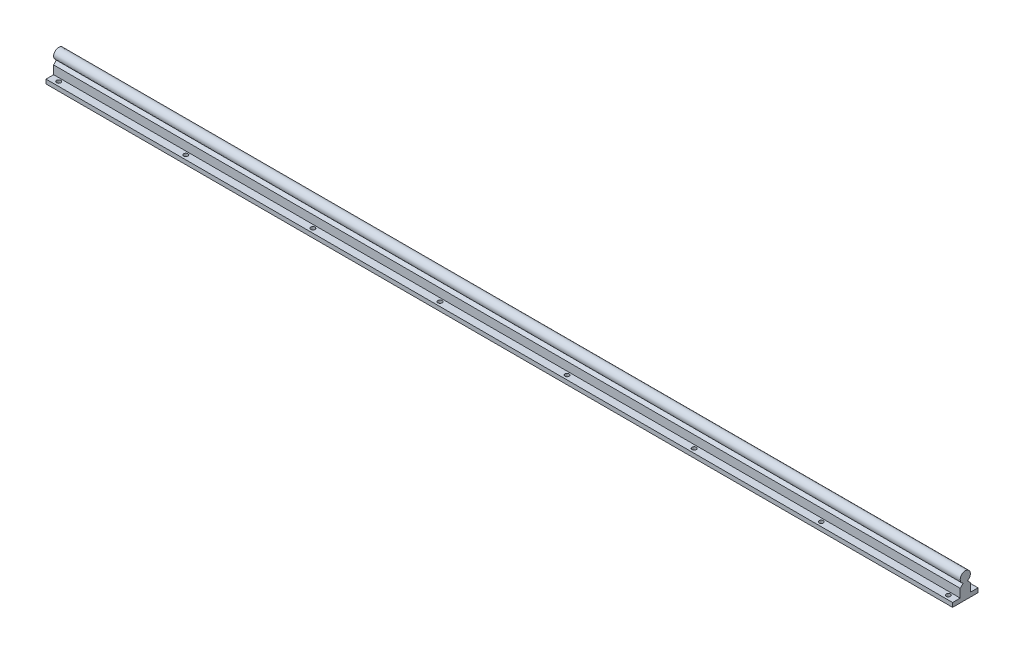
from build123d import *

# Parameters (mm, degrees)
EXTRUDE_1_DEPTH        = 535
SKETCH_2_R             = 2.5
CUT_EXTRUDE_1_DEPTH    = 1070
PATTERN_LINEAR_1_COUNT = 8
PATTERN_LINEAR_1_PITCH = 150


with BuildPart() as part:
    # Эскиз1 → Бобышка-Вытянуть1 (new, symmetric)
    with BuildSketch(Plane(origin=(0, 0, 0), x_dir=(0, 0, -1), z_dir=(1, 0, 0))):
        with BuildLine():
            Line((-6, 15), (-2.5, 18.545643943))
            ThreePointArc((-2.5, 18.545643943), (0, 30), (2.5, 18.545643943))
            Line((2.5, 18.545643943), (6, 15))
            Line((6, 15), (6, 5))
            Line((6, 5), (15, 5))
            Line((15, 5), (15, 0))
            Line((15, 0), (-15, 0))
            Line((-15, 0), (-15, 5))
            Line((-15, 5), (-6, 5))
            Line((-6, 5), (-6, 15))
        make_face()
    extrude(amount=EXTRUDE_1_DEPTH, both=True)

    # Эскиз2 → Вырез-Вытянуть1 (cut)
    with BuildSketch(Plane.XZ):
        with Locations((-525, 10)):
            Circle(SKETCH_2_R)
        with Locations((-525, -10)):
            Circle(SKETCH_2_R)
    cut_extrude_1 = extrude(amount=-CUT_EXTRUDE_1_DEPTH, mode=Mode.SUBTRACT)

    # Линейный массив1: Вырез-Вытянуть1 ×8
    with Locations(*[(i * PATTERN_LINEAR_1_PITCH, 0, 0) for i in range(1, PATTERN_LINEAR_1_COUNT)]):
        add(cut_extrude_1, mode=Mode.SUBTRACT)


solid = part.part
